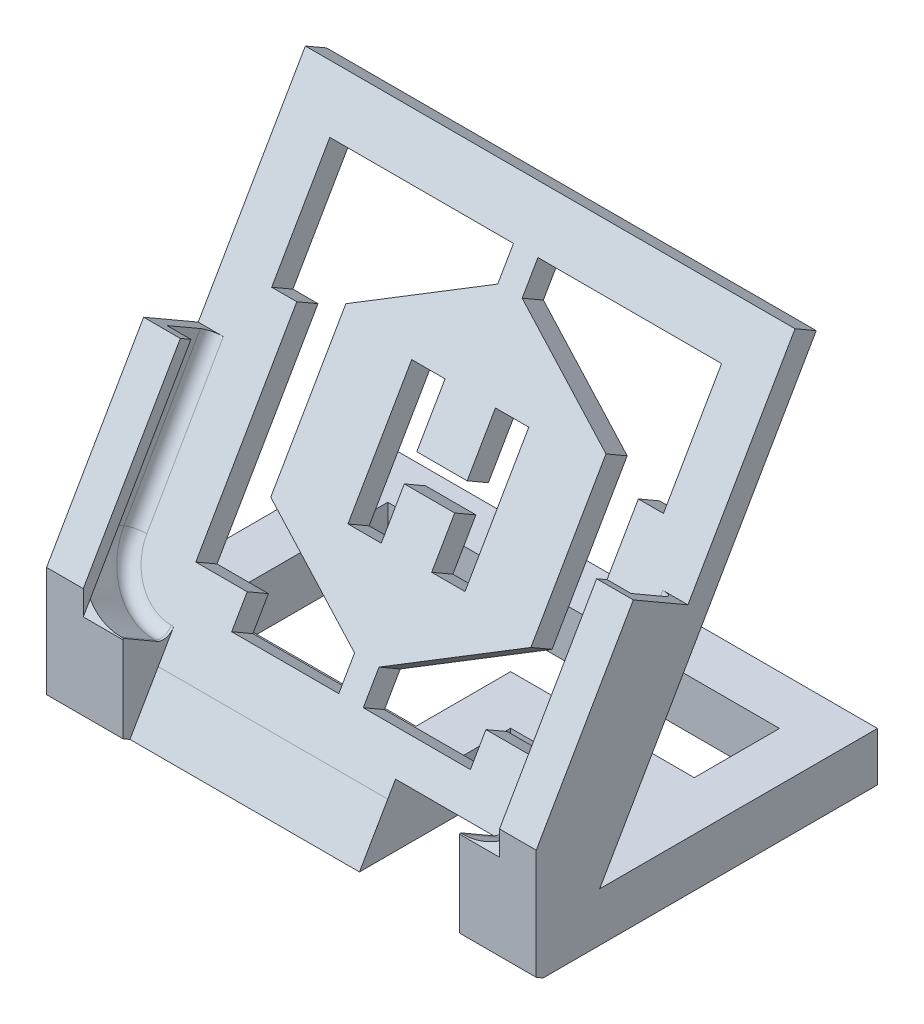
from build123d import *
from OCP.BRepFilletAPI import BRepFilletAPI_MakeChamfer

# Parameters (mm, degrees)
SKETCH1_W           = 80
SKETCH1_H           = 50
BOSS_EXTRUDE1_DEPTH = 8
BOSS_EXTRUDE2_DEPTH = 80
SKETCH3_W           = 2.1
SKETCH3_H           = 35
BOSS_EXTRUDE3_DEPTH = 8.3
FILLET1_R           = 10
FILLET2_R           = 2
BOSS_EXTRUDE4_DEPTH = 10
CHAMFER2_SIZE       = 17.320508076
CHAMFER2_SIZE_2     = 10
SKETCH5_W           = 12.5
SKETCH5_H           = 9.237604307
BOSS_EXTRUDE5_DEPTH = 8.3
SKETCH6_W           = 6
SKETCH6_H           = 47.309401077
BOSS_EXTRUDE6_DEPTH = 2
CHAMFER3_SIZE       = 9
CHAMFER3_SIZE2      = 15.588457268
SKETCH7_W           = 17.5
SKETCH7_H           = 11.773502692
CUT_EXTRUDE1_DEPTH  = 12
SKETCH8_W           = 17.5
SKETCH8_H           = 15
CUT_EXTRUDE2_DEPTH  = 12
CUT_EXTRUDE3_DEPTH  = 12
CUT_EXTRUDE4_DEPTH  = 4
BOSS_EXTRUDE7_DEPTH = 4
CUT_EXTRUDE5_REACH  = 87.126
SKETCH12_W          = 17.5
SKETCH12_H          = 2.535898385


with BuildPart() as part:
    # Sketch1 → Boss-Extrude1 (new body)
    with BuildSketch(Plane(origin=(0, 0, 0), x_dir=(1, 0, 0), z_dir=(0, 1, 0))):
        Rectangle(SKETCH1_W, SKETCH1_H)
    extrude(amount=BOSS_EXTRUDE1_DEPTH)

    # Sketch2 → Boss-Extrude2 (add)
    with BuildSketch(Plane(origin=(40, 0, 0), x_dir=(0, 0, -1), z_dir=(1, 0, 0))):
        Polygon((15, 69.282032303), (11.535898385, 71.282032303), (-25, 8), (-20.381197846, 8), align=None)
    extrude(amount=-BOSS_EXTRUDE2_DEPTH)

    # Sketch3 → Boss-Extrude3 (add)
    with BuildSketch(Plane(origin=(0, 12.825317547, 22.214101615), x_dir=(1, 0, 0), z_dir=(0, 0.5000000000000041, 0.8660254037844364))):
        with Locations((-38.95, 15)):
            Rectangle(SKETCH3_W, SKETCH3_H)
        Polygon((-27.5, -5.57179677), (-27.5, -2.5), (-37.9, -2.5), (-40, -2.5), (-40, -5.57179677), align=None)
        Polygon((40, -5.57179677), (40, -2.5), (37.9, -2.5), (27.5, -2.5), (27.5, -5.57179677), align=None)
        with Locations((38.95, 15)):
            Rectangle(SKETCH3_W, SKETCH3_H)
    extrude(amount=BOSS_EXTRUDE3_DEPTH)

    # Fillet1
    fillet1_edges = [part.edges().sort_by_distance(p)[0] for p in [
        (-37.9, 12.735254038, 27.058107041),
        (37.9, 12.735254038, 27.058107041),
    ]]
    fillet(fillet1_edges, radius=FILLET1_R)

    # Fillet2
    fillet2_edges = [part.edges().sort_by_distance(p)[0] for p in [
        (-27.7, 10.660254038, 23.464101615),
        (-37.9, 30.145825623, 12.214101615),
        (27.7, 10.660254038, 23.464101615),
        (37.9, 30.145825623, 12.214101615),
        (34.971067812, 13.196783719, 21.999635521),
        (-34.971067812, 13.196783719, 21.999635521),
    ]]
    fillet(fillet2_edges, radius=FILLET2_R)

    # Sketch4 → Boss-Extrude4 (add)
    with BuildSketch(Plane.XY.offset(25)):
        Polygon((40, 0), (40, 8), (27.5, 8), (-27.5, 8), (-40, 8), (-40, 0), align=None)
    extrude(amount=BOSS_EXTRUDE4_DEPTH)

    # Chamfer2
    # the kernel refuses this chamfer: 17.320508076, 10 mm, written as the material it takes off along each edge
    with BuildSketch(Plane(origin=(-84.809639706, 8, 35), x_dir=(0, -0.999813220622208, 0.019326765612700497), z_dir=(1, 0, 0))) as chamfer2_piece_1:
        Polygon((CHAMFER2_SIZE * 0.999813220604, CHAMFER2_SIZE * 0.0193267656124), (-CHAMFER2_SIZE_2 * 0.0193267656127, CHAMFER2_SIZE_2 * 0.999813220622), (0, 0), align=None)
    extrude(amount=169.619279412, mode=Mode.SUBTRACT)

    # Sketch5 → Boss-Extrude5 (add)
    with BuildSketch(Plane(origin=(0, 12.825317547, 22.214101615), x_dir=(1, 0, 0), z_dir=(0, 0.49999999999999656, 0.8660254037844407))):
        with Locations((-33.75, -10.190598924)):
            Rectangle(SKETCH5_W, SKETCH5_H)
        with Locations((33.75, -10.190598924)):
            Rectangle(SKETCH5_W, SKETCH5_H)
    extrude(amount=BOSS_EXTRUDE5_DEPTH)

    # Sketch6 → Boss-Extrude6 (add)
    with BuildSketch(Plane(origin=(0, 16.975317547, 29.402112467), x_dir=(1, 0, 0), z_dir=(0, 0.5000000000000041, 0.8660254037844364))):
        with Locations((-37, 8.845299461)):
            Rectangle(SKETCH6_W, SKETCH6_H)
        with Locations((37, 8.845299461)):
            Rectangle(SKETCH6_W, SKETCH6_H)
    extrude(amount=BOSS_EXTRUDE6_DEPTH)

    # Chamfer3: one chamfer whose edges measure the first distance from different faces: ONE call of the kernel's chamfer builder (chamfer() names one face for all edges)
    chamfer3_edges_1 = [part.edges().sort_by_distance(p)[0] for p in [
        (-37, 5.15, 38.538863812),
    ]]
    chamfer3_side_1 = [part.faces().sort_by_distance(p)[0] for p in [
        (-34.086933045, 2.341954644, 33.675186585),
    ]]
    chamfer3_edges_2 = [part.edges().sort_by_distance(p)[0] for p in [
        (37, 5.15, 38.538863812),
    ]]
    chamfer3_side_2 = [part.faces().sort_by_distance(p)[0] for p in [
        (34.086933045, 2.341954644, 33.675186585),
    ]]
    chamfer3 = BRepFilletAPI_MakeChamfer(part.part.solid().wrapped)
    for e in chamfer3_edges_1:
        chamfer3.Add(CHAMFER3_SIZE, CHAMFER3_SIZE2, e.wrapped, chamfer3_side_1[0].wrapped)  # the first distance lies on this face
    for e in chamfer3_edges_2:
        chamfer3.Add(CHAMFER3_SIZE, CHAMFER3_SIZE2, e.wrapped, chamfer3_side_2[0].wrapped)  # the first distance lies on this face
    add(Compound.cast(chamfer3.Shape()), mode=Mode.REPLACE)

    # Sketch7 → Cut-Extrude1 (cut)
    with BuildSketch(Plane(origin=(0, 12.825317547, 22.214101615), x_dir=(1, 0, 0), z_dir=(0, 0.49999999999999656, 0.8660254037844407))):
        with Locations((18.75, -8.922649731)):
            Rectangle(SKETCH7_W, SKETCH7_H)
    extrude(amount=-CUT_EXTRUDE1_DEPTH, mode=Mode.SUBTRACT)

    # Sketch8 → Cut-Extrude2 (cut)
    with BuildSketch(Plane(origin=(0, 8, 0), x_dir=(1, 0, 0), z_dir=(0, 1, 0))):
        with Locations((18.75, -12.42820323)):
            Rectangle(SKETCH8_W, SKETCH8_H)
    extrude(amount=-CUT_EXTRUDE2_DEPTH, mode=Mode.SUBTRACT)

    # Sketch9 → Cut-Extrude3 (cut)
    with BuildSketch(Plane(origin=(0, 8, 0), x_dir=(1, 0, 0), z_dir=(0, 1, 0))):
        Polygon((-32, -12.381197846), (2, -12.381197846), (2, 3.07179677), (32, 3.07179677), (32, 17), (-32, 17), align=None)
    extrude(amount=-CUT_EXTRUDE3_DEPTH, mode=Mode.SUBTRACT)

    # Sketch10 → Cut-Extrude4 (cut)
    with BuildSketch(Plane(origin=(0, 12.825317547, 22.214101615), x_dir=(1, 0, 0), z_dir=(0, 0.500000000000004, 0.8660254037844365))):
        Polygon((-19.5, 7.5), (-19.5, 2.42820323), (2, 2.42820323), (2, 4.964101615), (19.5, 4.964101615), (19.5, 7.5), (27.9, 7.5), (27.9, 40.5), (32, 40.5), (32, 59.5), (-32, 59.5), (-32, 40.5), (-27.9, 40.5), (-27.9, 7.5), align=None)
    extrude(amount=-CUT_EXTRUDE4_DEPTH, mode=Mode.SUBTRACT)

    # Sketch11 → Boss-Extrude7 (add)
    with BuildSketch(Plane(origin=(0, 12.825317547, 22.214101615), x_dir=(1, 0, 0), z_dir=(0, 0.500000000000004, 0.8660254037844365))):
        Polygon((-2, 32.140001961), (-2, 54.345299462), (-21.248711306, 43.232050808), (-21.248711306, 18.696152423), (-2, 7.582903769), (-2, 28.066803955), (-4.115553581, 28.066803955), (-4.115553581, 20.544526768), (-9.563712394, 20.544526768), (-9.563712394, 41.383676462), (-4.115553581, 41.383676462), (-4.115553581, 32.140001961), align=None)
        Polygon((21.248711306, 43.232050808), (2, 54.345299462), (2, 32.140001961), (4.115553581, 32.140001961), (4.115553581, 41.383676462), (9.563712394, 41.383676462), (9.563712394, 20.544526768), (4.115553581, 20.544526768), (4.115553581, 28.066803955), (2, 28.066803955), (2, 7.582903769), (21.248711306, 18.696152423), align=None)
        Polygon((2, 54.345299462), (0, 55.5), (-2, 54.345299462), (-2, 32.140001961), (0, 32.140001961), (2, 32.140001961), align=None)
        Polygon((-2, 54.345299462), (0, 55.5), (2, 54.345299462), (2, 59.5), (-2, 59.5), align=None)
        Polygon((0, 6.42820323), (-2, 7.582903769), (-2, 2.42820323), (2, 2.42820323), (2, 4.964101615), (2, 7.582903769), align=None)
        Polygon((0, 28.066803955), (-2, 28.066803955), (-2, 7.582903769), (0, 6.42820323), (2, 7.582903769), (2, 28.066803955), align=None)
    extrude(amount=-BOSS_EXTRUDE7_DEPTH)

    # Sketch12 → Cut-Extrude5 (cut, up to next)
    with BuildSketch(Plane(origin=(0, 12.825317547, 22.214101615), x_dir=(1, 0, 0), z_dir=(0, 0.500000000000004, 0.8660254037844365)), mode=Mode.PRIVATE) as cut_extrude5_sk1:
        with Locations((10.75, 3.696152423)):
            Rectangle(SKETCH12_W, SKETCH12_H)
    cut_extrude5_tool1 = extrude(cut_extrude5_sk1.sketch, amount=-CUT_EXTRUDE5_REACH, mode=Mode.PRIVATE) & part.part
    add(cut_extrude5_tool1.solids().sort_by_distance((10.75, 16.026279, 20.366025))[0], mode=Mode.SUBTRACT)


solid = part.part
